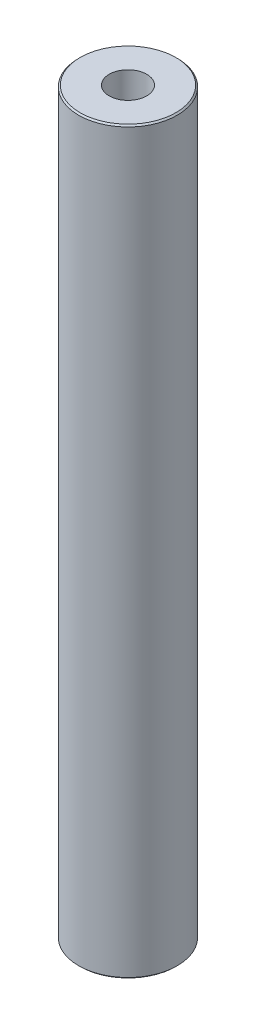
from build123d import *
from OCP.BRepFilletAPI import BRepFilletAPI_MakeChamfer

# Parameters (mm, degrees)
SKETCH1_R           = 40
BOSS_EXTRUDE1_DEPTH = 600
SKETCH2_R           = 15.235727128
CUT_EXTRUDE1_DEPTH  = 603.660766933
CHAMFER1_SIZE       = 1.181741123
CHAMFER1_SIZE2      = 1.157885618


with BuildPart() as part:
    # Sketch1 → Boss-Extrude1 (new body)
    with BuildSketch(Plane(origin=(0, 0, 0), x_dir=(1, 0, 0), z_dir=(0, 1, 0))):
        Circle(SKETCH1_R)
    extrude(amount=BOSS_EXTRUDE1_DEPTH)

    # Sketch2 → Cut-Extrude1 (cut, through all)
    with BuildSketch(Plane(origin=(0, 0, 0), x_dir=(1, 0, 0), z_dir=(0, 1, 0))):
        Circle(SKETCH2_R)
    extrude(amount=CUT_EXTRUDE1_DEPTH, mode=Mode.SUBTRACT)

    # Chamfer1: one chamfer whose edges measure the first distance from different faces: ONE call of the kernel's chamfer builder (chamfer() names one face for all edges)
    chamfer1_edges_1 = [part.edges().sort_by_distance(p)[0] for p in [
        (-40, 600, 0),
    ]]
    chamfer1_side_1 = [part.faces().sort_by_distance(p)[0] for p in [
        (-40, 300, 0),
    ]]
    chamfer1_edges_2 = [part.edges().sort_by_distance(p)[0] for p in [
        (-40, 0, 0),
    ]]
    chamfer1_side_2 = [part.faces().sort_by_distance(p)[0] for p in [
        (-38.86862915, 0, 0),
    ]]
    chamfer1 = BRepFilletAPI_MakeChamfer(part.part.solid().wrapped)
    for e in chamfer1_edges_1:
        chamfer1.Add(CHAMFER1_SIZE, CHAMFER1_SIZE2, e.wrapped, chamfer1_side_1[0].wrapped)  # the first distance lies on this face
    for e in chamfer1_edges_2:
        chamfer1.Add(CHAMFER1_SIZE, CHAMFER1_SIZE2, e.wrapped, chamfer1_side_2[0].wrapped)  # the first distance lies on this face
    add(Compound.cast(chamfer1.Shape()), mode=Mode.REPLACE)


solid = part.part
